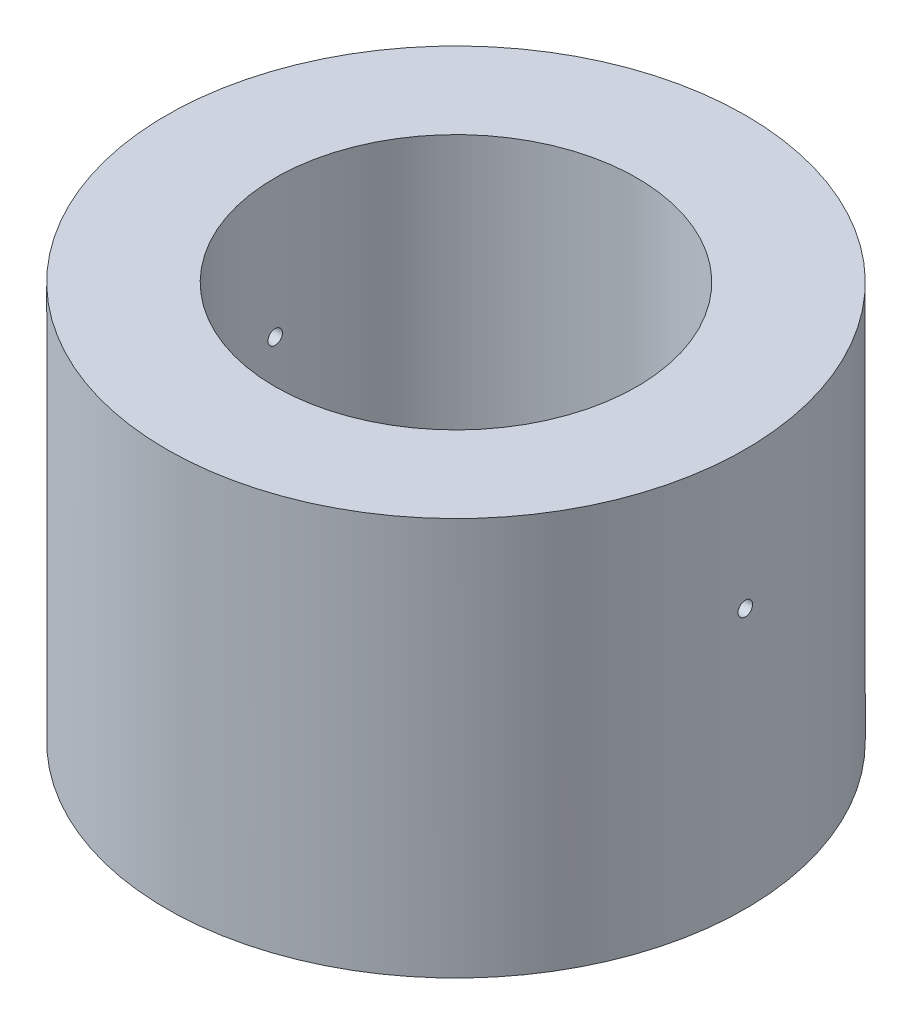
from build123d import *

# Parameters (mm, degrees)
SKETCH1_R               = 40
SKETCH1_R_2             = 25
BOSS_EXTRUDE1_DEPTH     = 50
BOSS_EXTRUDE2_START     = 5
SKETCH2_R               = 40
SKETCH2_R_2             = 37.5
BOSS_EXTRUDE2_DEPTH     = 5
CUT_EXTRUDE2_DEPTH      = 76.498344353
CUT_EXTRUDE2_DEPTH_BACK = 76.498344353
SKETCH3_R               = 1


with BuildPart() as part:
    # Sketch1 → Boss-Extrude1 (new body)
    with BuildSketch(Plane(origin=(0, 0, 0), x_dir=(1, 0, 0), z_dir=(0, 1, 0))):
        Circle(SKETCH1_R)
        Circle(SKETCH1_R_2, mode=Mode.SUBTRACT)
    extrude(amount=BOSS_EXTRUDE1_DEPTH)

    # Sketch2 → Boss-Extrude2 (add)
    with BuildSketch(Plane.XZ.offset(BOSS_EXTRUDE2_START)):
        Circle(SKETCH2_R)
        Circle(SKETCH2_R_2, mode=Mode.SUBTRACT)
    extrude(amount=-BOSS_EXTRUDE2_DEPTH)

    # Sketch3 → Cut-Extrude2 (cut, two sides: drawn at the far end of the back side and taken through both)
    with BuildSketch(Plane(origin=(0, 0, 0), x_dir=(0, 0, -1), z_dir=(1, 0, 0)).offset(-CUT_EXTRUDE2_DEPTH_BACK)):
        with Locations((0, 30.95)):
            Circle(SKETCH3_R)
    extrude(amount=CUT_EXTRUDE2_DEPTH + CUT_EXTRUDE2_DEPTH_BACK, mode=Mode.SUBTRACT)


solid = part.part
